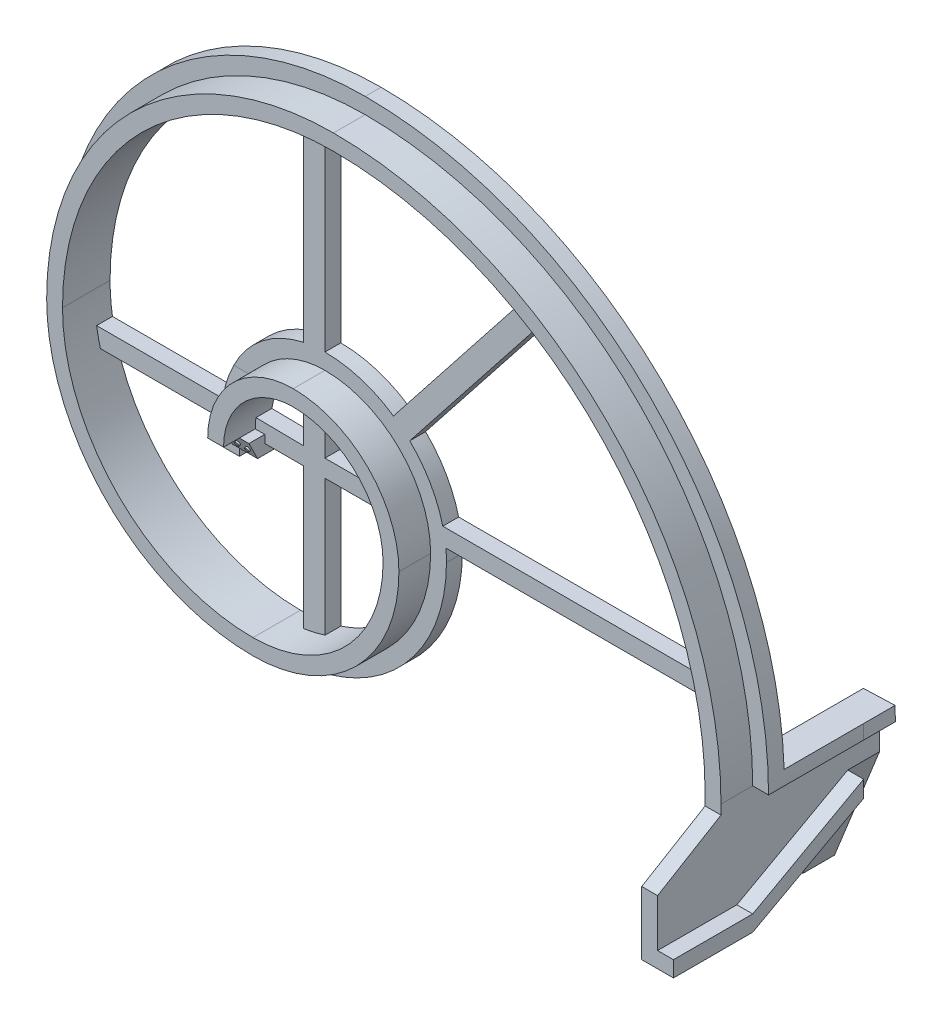
from build123d import *

# Parameters (mm, degrees)
EXTRUDE2_DEPTH      = 10
EXTRUDE3_START      = -5
EXTRUDE3_DEPTH      = 5
CUT_EXTRUDE1_DEPTH  = 5
EXTRUDE4_DEPTH      = 3
CUT_EXTRUDE2_DEPTH  = 8
EXTRUDE5_DEPTH      = 5
EXTRUDE5_DEPTH_BACK = 5
CUT_EXTRUDE3_DEPTH  = 5
SKETCH9_W           = 5
SKETCH9_H           = 15
EXTRUDE6_DEPTH      = 35
SKETCH11_W          = 5
SKETCH11_H          = 35
EXTRUDE8_DEPTH      = 25
EXTRUDE9_START      = 25
EXTRUDE9_DEPTH      = 25
EXTRUDE12_DEPTH     = 20
EXTRUDE13_DEPTH     = 5
CUT_EXTRUDE5_DEPTH  = 5
EXTRUDE14_DEPTH     = 10
EXTRUDE19_START     = -5
EXTRUDE19_DEPTH     = 5
SKETCH21_R          = 0.7
EXTRUDE20_DEPTH     = 0.5


with BuildPart() as part:
    # Sketch2 → Extrude2 (new body)
    with BuildSketch(Plane.XY):
        with BuildLine():
            Line((-26.9875, 0), (-26.9875, -10))
            Line((-26.9875, -10), (-21.9875, -10))
            Line((-21.9875, -10), (-21.9875, 0))
            ThreePointArc((-21.9875, 0), (-15.547510351, 15.547510351), (0, 21.9875))
            ThreePointArc((0, 21.9875), (20.037638412, 13.687638412), (28.3375, -6.35))
            ThreePointArc((28.3375, -6.35), (16.317894533, -35.367894533), (-12.7, -47.3875))
            ThreePointArc((-12.7, -47.3875), (-55.188278715, -29.788278715), (-72.7875, 12.7))
            ThreePointArc((-72.7875, 12.7), (-47.748790957, 73.148790957), (12.7, 98.1875))
            ThreePointArc((12.7, 98.1875), (95.599431259, 63.849431259), (129.9375, -19.05))
            Line((129.9375, -19.05), (134.9375, -19.05))
            ThreePointArc((134.9375, -19.05), (99.134965165, 67.384965165), (12.7, 103.1875))
            ThreePointArc((12.7, 103.1875), (-51.284324863, 76.684324863), (-77.7875, 12.7))
            ThreePointArc((-77.7875, 12.7), (-58.72381262, -33.32381262), (-12.7, -52.3875))
            ThreePointArc((-12.7, -52.3875), (19.853428439, -38.903428439), (33.3375, -6.35))
            ThreePointArc((33.3375, -6.35), (23.573172318, 17.223172318), (0, 26.9875))
            ThreePointArc((0, 26.9875), (-19.083044257, 19.083044257), (-26.9875, 0))
        make_face()
    extrude(amount=EXTRUDE2_DEPTH)

    # Sketch3 → Extrude3 (add)
    with BuildSketch(Plane.XY.offset(EXTRUDE3_START)):
        with BuildLine():
            Line((-21.9875, 0), (-21.9875, -10))
            Line((-21.9875, -10), (-31.9875, -10))
            Line((-31.9875, -10), (-31.9875, 0))
            ThreePointArc((-31.9875, 0), (-22.618578163, 22.618578163), (0, 31.9875))
            ThreePointArc((0, 31.9875), (27.108706224, 20.758706224), (38.3375, -6.35))
            ThreePointArc((38.3375, -6.35), (23.388962345, -42.438962345), (-12.7, -57.3875))
            ThreePointArc((-12.7, -57.3875), (-62.259346526, -36.859346526), (-82.7875, 12.7))
            ThreePointArc((-82.7875, 12.7), (-54.819858769, 80.219858769), (12.7, 108.1875))
            ThreePointArc((12.7, 108.1875), (102.670499071, 70.920499071), (139.9375, -19.05))
            Line((139.9375, -19.05), (129.9375, -19.05))
            ThreePointArc((129.9375, -19.05), (95.599431259, 63.849431259), (12.7, 98.1875))
            ThreePointArc((12.7, 98.1875), (-47.748790957, 73.148790957), (-72.7875, 12.7))
            ThreePointArc((-72.7875, 12.7), (-55.188278715, -29.788278715), (-12.7, -47.3875))
            ThreePointArc((-12.7, -47.3875), (16.317894533, -35.367894533), (28.3375, -6.35))
            ThreePointArc((28.3375, -6.35), (20.037638412, 13.687638412), (0, 21.9875))
            ThreePointArc((0, 21.9875), (-15.547510351, 15.547510351), (-21.9875, 0))
        make_face()
    extrude(amount=EXTRUDE3_DEPTH)

    # Sketch4 → Cut-Extrude1 (cut)
    with BuildSketch(Plane.ZY.offset(26.9875)):
        Polygon((0, -10), (5, 0), (10, 0), (10, -10), align=None)
    extrude(amount=-CUT_EXTRUDE1_DEPTH, mode=Mode.SUBTRACT)

    # Sketch5 → Extrude4 (add)
    with BuildSketch(Plane(origin=(-21.9875, 0, 0), x_dir=(0, 0, -1), z_dir=(1, 0, 0))):
        Polygon((0, -10), (-5, 0), (0, 0), (5, 0), (5, -10), align=None)
    extrude(amount=EXTRUDE4_DEPTH)

    # Sketch6 → Cut-Extrude2 (cut)
    with BuildSketch(Plane(origin=(-18.9875, 0, 0), x_dir=(0, 0, -1), z_dir=(1, 0, 0))):
        Polygon((5, -5.5), (-2.25, -5.5), (0, -10), (5, -10), align=None)
    extrude(amount=-CUT_EXTRUDE2_DEPTH, mode=Mode.SUBTRACT)

    # Sketch7 → Extrude5 (add, two sides: drawn at the far end of the back side and taken through both)
    with BuildSketch(Plane.ZY.offset(26.9875).offset(-EXTRUDE5_DEPTH_BACK)):
        Polygon((0, -5.5), (0.798113635, -5.5), (0, 14), align=None)
    extrude(amount=EXTRUDE5_DEPTH + EXTRUDE5_DEPTH_BACK)

    # Sketch8 → Cut-Extrude3 (cut)
    with BuildSketch(Plane.XY):
        with BuildLine():
            Line((-28.761087536, 14), (-31.9875, 14))
            Line((-31.9875, 14), (-31.9875, 0))
            ThreePointArc((-31.9875, 0), (-31.170462331, 7.183483441), (-28.761087536, 14))
        make_face()
    extrude(amount=CUT_EXTRUDE3_DEPTH, mode=Mode.SUBTRACT)

    # Sketch9 → Extrude6 (add)
    with BuildSketch(Plane.XZ.offset(19.05)):
        with Locations((132.4375, 2.5)):
            Rectangle(SKETCH9_W, SKETCH9_H)
    extrude(amount=EXTRUDE6_DEPTH)

    # Sketch11 → Extrude8 (add)
    with BuildSketch(Plane(origin=(0, 0, -5), x_dir=(-1, 0, 0), z_dir=(0, 0, -1))):
        with Locations((-132.4375, -36.55)):
            Rectangle(SKETCH11_W, SKETCH11_H)
    extrude(amount=EXTRUDE8_DEPTH)

    # Sketch12 → Extrude9 (add)
    with BuildSketch(Plane(origin=(0, 0, -5), x_dir=(-1, 0, 0), z_dir=(0, 0, -1)).offset(EXTRUDE9_START)):
        with BuildLine():
            Line((-129.9375, -19.05), (-139.9375, -19.05))
            ThreePointArc((-139.9375, -19.05), (-139.918121112, -16.829399436), (-139.859990353, -14.609475288))
            Line((-139.859990353, -14.609475288), (-129.866082083, -14.958470255))
            ThreePointArc((-129.866082083, -14.958470255), (-129.919644161, -17.0039235), (-129.9375, -19.05))
        make_face()
    extrude(amount=-EXTRUDE9_DEPTH)

    # Sketch16 → Extrude12 (add)
    with BuildSketch(Plane.XY.offset(10)):
        Polygon((129.9375, -19.05), (129.9375, -54.05), (139.9375, -54.05), (139.9375, -49.05), (134.9375, -49.05), (134.9375, -19.05), align=None)
    extrude(amount=EXTRUDE12_DEPTH)

    # Sketch17 → Extrude13 (add)
    with BuildSketch(Plane(origin=(134.9375, 0, 0), x_dir=(0, 0, -1), z_dir=(1, 0, 0))):
        Polygon((-10, -54.05), (-10, -49.05), (-5, -49.05), (30, -29.72873513), (30, -34.988734421), (-5, -54.05), align=None)
    extrude(amount=EXTRUDE13_DEPTH)

    # Sketch18 → Cut-Extrude5 (cut)
    with BuildSketch(Plane(origin=(134.9375, 0, 0), x_dir=(0, 0, -1), z_dir=(1, 0, 0))):
        Polygon((-5, -54.05), (30, -34.988734421), (30, -54.05), align=None)
        Polygon((-30, -19.05), (-30, -34.05), (-10, -22.05), (-10, -19.05), align=None)
    extrude(amount=-CUT_EXTRUDE5_DEPTH, mode=Mode.SUBTRACT)

    # Sketch19 → Extrude14 (add)
    with BuildSketch(Plane(origin=(0, 0, -30), x_dir=(-1, 0, 0), z_dir=(0, 0, -1))):
        Polygon((-134.9375, -19.05), (-134.9375, -29.72873513), (-120.74, -65.09), (-115.74, -65.09), (-129.9375, -29.72873513), (-129.866082083, -14.958470255), (-139.859990353, -14.609475288), (-139.9375, -19.05), align=None)
    extrude(amount=EXTRUDE14_DEPTH)

    # Sketch20 → Extrude19 (add)
    with BuildSketch(Plane.XY.offset(EXTRUDE19_START)):
        with BuildLine():
            Line((128.760903372, -2.482015371), (38.141874641, -2.482015371))
            ThreePointArc((38.141874641, -2.482015371), (37.760120708, 0.278513435), (37.178841709, 3.004017073))
            Line((37.178841709, 3.004017073), (127.844482009, 3.004017073))
            ThreePointArc((127.844482009, 3.004017073), (128.335231203, 0.266436289), (128.760903372, -2.482015371))
        make_face()
        with BuildLine():
            Line((0, 31.9875), (0, 97.238882511))
            ThreePointArc((0, 97.238882511), (-3.385770157, 96.660470787), (-6.745571925, 95.946515776))
            Line((-6.745571925, 95.946515776), (-6.745571925, 31.268153378))
            ThreePointArc((-6.745571925, 31.268153378), (-3.391909497, 31.807154953), (0, 31.9875))
        make_face()
        with BuildLine():
            Line((-0.000749496, 21.987499987), (-0.000749496, 3.004017073))
            Line((-0.000749496, 3.004017073), (26.74913589, 3.004017073))
            ThreePointArc((26.74913589, 3.004017073), (27.547611511, 0.294020339), (28.072274599, -2.482015371))
            Line((28.072274599, -2.482015371), (0.080484541, -2.482015371))
            Line((0.080484541, -2.482015371), (0.080484541, -45.312306862))
            ThreePointArc((0.080484541, -45.312306862), (-3.298138872, -46.262230565), (-6.745571925, -46.919996909))
            Line((-6.745571925, -46.919996909), (-6.745571925, -2.482015371))
            Line((-6.745571925, -2.482015371), (-18.9875, -2.482015371))
            Line((-18.9875, -2.482015371), (-18.9875, 0))
            Line((-18.9875, 0), (-21.9875, 0))
            ThreePointArc((-21.9875, 0), (-21.928738235, 1.606423254), (-21.752767023, 3.20426015))
            Line((-21.752767023, 3.20426015), (-6.745571925, 3.004017073))
            Line((-6.745571925, 3.004017073), (-6.745571925, 20.92719321))
            ThreePointArc((-6.745571925, 20.92719321), (-3.414568171, 21.720747696), (-0.000749496, 21.987499987))
        make_face()
        with BuildLine():
            Line((-31.826606372, 3.20426015), (-50.922171332, 3.20426015))
            Line((-50.922171332, 3.20426015), (-72.032441219, 3.20426015))
            ThreePointArc((-72.032441219, 3.20426015), (-71.503716958, 0.345627166), (-70.83734731, -2.484087197))
            Line((-70.83734731, -2.484087197), (-50.922171332, -2.484087197))
            Line((-50.922171332, -2.484087197), (-31.9875, -2.484087197))
            Line((-31.9875, -2.484087197), (-31.9875, 0))
            ThreePointArc((-31.9875, 0), (-31.947251271, 1.604148518), (-31.826606372, 3.20426015))
        make_face()
        with BuildLine():
            Line((26.74913589, 21.11356924), (73.944333787, 80.918810062))
            ThreePointArc((73.944333787, 80.918810062), (71.049492521, 82.635633837), (68.106562726, 84.268653752))
            Line((68.106562726, 84.268653752), (21.610975976, 25.315906329))
            ThreePointArc((21.610975976, 25.315906329), (24.271176613, 23.326150223), (26.74913589, 21.11356924))
        make_face()
    extrude(amount=EXTRUDE19_DEPTH)

    # Sketch21 → Extrude20 (add)
    with BuildSketch(Plane(origin=(0, -2, 4), x_dir=(1, 0, 0), z_dir=(0, -0.4472135954999575, 0.8944271909999163))):
        with Locations((-23.8075, -1)):
            Circle(SKETCH21_R)
        with Locations((-20.6275, -1)):
            Circle(SKETCH21_R)
    extrude(amount=EXTRUDE20_DEPTH)


solid = part.part
